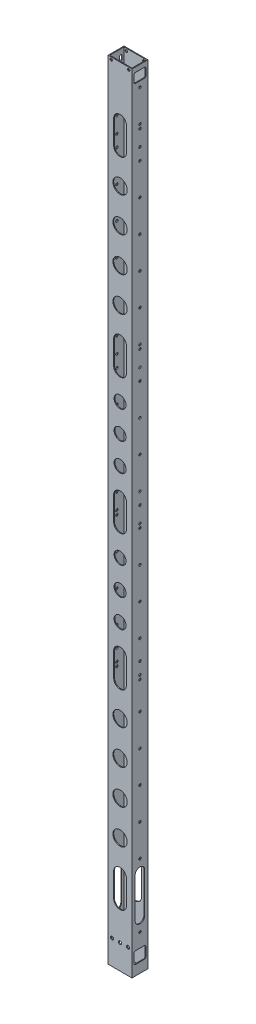
from build123d import *

# Parameters (mm, degrees)
SKETCH_1_W           = 30
SKETCH_1_H           = 20
SKETCH_1_W_2         = 28
SKETCH_1_H_2         = 18
EXTRUDE_1_DEPTH      = 980
SKETCH_3_R           = 1.5
CUT_EXTRUDE_2_DEPTH  = 981.51007134
CUT_EXTRUDE_3_DEPTH  = 981.51007134
SKETCH_5_W           = 15
SKETCH_5_H           = 12
CUT_EXTRUDE_4_DEPTH  = 10
SKETCH_6_R           = 9
SKETCH_6_R_2         = 7.5
CUT_EXTRUDE_5_DEPTH  = 981.318825689
SKETCH_9_R           = 1.5
CUT_EXTRUDE_7_DEPTH  = 981.318825689
SKETCH_13_W          = 30
SKETCH_13_H          = 20
SKETCH_13_W_2        = 28
SKETCH_13_H_2        = 18
EXTRUDE_2_DEPTH      = 10
CUT_EXTRUDE_8_DEPTH  = 60
SKETCH_15_W          = 15
SKETCH_15_H          = 15
CUT_EXTRUDE_10_DEPTH = 5
FILLET_1_R           = 2
SKETCH_16_R          = 2
CUT_EXTRUDE_11_DEPTH = 90
FILLET_2_R           = 2
SKETCH_17_R          = 1.5
CUT_EXTRUDE_12_DEPTH = 40
CUT_EXTRUDE_15_DEPTH = 51


with BuildPart() as part:
    # 草图1 → 凸台-拉伸1 (new body)
    with BuildSketch(Plane(origin=(0, 0, 0), x_dir=(1, 0, 0), z_dir=(0, 1, 0))):
        Rectangle(SKETCH_1_W, SKETCH_1_H)
        Rectangle(SKETCH_1_W_2, SKETCH_1_H_2, mode=Mode.SUBTRACT)
    extrude(amount=EXTRUDE_1_DEPTH)

    # 草图3 → 切除-拉伸2 (cut, through all)
    with BuildSketch(Plane(origin=(15, 0, 0), x_dir=(0, 0, -1), z_dir=(1, 0, 0))):
        with Locations((0, 890)):
            Circle(SKETCH_3_R)
        with Locations((0, 910)):
            Circle(SKETCH_3_R)
        with Locations((0, 500)):
            Circle(SKETCH_3_R)
        with Locations((0, 480)):
            Circle(SKETCH_3_R)
        with Locations((0, 670)):
            Circle(SKETCH_3_R)
        with Locations((0, 650)):
            Circle(SKETCH_3_R)
        with Locations((0, 330)):
            Circle(SKETCH_3_R)
        with Locations((0, 310)):
            Circle(SKETCH_3_R)
        with Locations((0, 70)):
            Circle(SKETCH_3_R)
        with Locations((0, 90)):
            Circle(SKETCH_3_R)
    extrude(amount=-CUT_EXTRUDE_2_DEPTH, mode=Mode.SUBTRACT)

    # 草图4 → 切除-拉伸3 (cut, through all)
    with BuildSketch(Plane(origin=(15, 0, 0), x_dir=(0, 0, -1), z_dir=(1, 0, 0))):
        with BuildLine():
            Line((3.4, 968), (3.4, 972))
            ThreePointArc((3.4, 972), (5, 973.6), (6.6, 972))
            Line((6.6, 972), (6.6, 968))
            ThreePointArc((6.6, 968), (5, 966.4), (3.4, 968))
        make_face()
        with BuildLine():
            Line((-3.4, 968), (-3.4, 972))
            ThreePointArc((-3.4, 972), (-5, 973.6), (-6.6, 972))
            Line((-6.6, 972), (-6.6, 968))
            ThreePointArc((-6.6, 968), (-5, 966.4), (-3.4, 968))
        make_face()
    extrude(amount=-CUT_EXTRUDE_3_DEPTH, mode=Mode.SUBTRACT)

    # 草图5 → 切除-拉伸4 (cut)
    with BuildSketch(Plane(origin=(15, 0, 0), x_dir=(0, 0, -1), z_dir=(1, 0, 0))):
        with Locations((0, 968)):
            Rectangle(SKETCH_5_W, SKETCH_5_H)
    extrude(amount=-CUT_EXTRUDE_4_DEPTH, mode=Mode.SUBTRACT)

    # 草图6 → 切除-拉伸5 (cut, through all)
    with BuildSketch(Plane(origin=(0, 0, -10), x_dir=(-1, 0, 0), z_dir=(0, 0, -1))):
        with Locations((0, 135)):
            Circle(SKETCH_6_R)
        with Locations((0, 178.333333333)):
            Circle(SKETCH_6_R)
        with Locations((0, 221.666666667)):
            Circle(SKETCH_6_R)
        with Locations((0, 265)):
            Circle(SKETCH_6_R)
        with Locations((0, 845)):
            Circle(SKETCH_6_R)
        with Locations((0, 801.666666667)):
            Circle(SKETCH_6_R)
        with Locations((0, 758.333333333)):
            Circle(SKETCH_6_R)
        with Locations((0, 715)):
            Circle(SKETCH_6_R)
        with Locations((0, 440)):
            Circle(SKETCH_6_R_2)
        with Locations((0, 405)):
            Circle(SKETCH_6_R_2)
        with Locations((0, 370)):
            Circle(SKETCH_6_R_2)
        with Locations((0, 610)):
            Circle(SKETCH_6_R_2)
        with Locations((0, 575)):
            Circle(SKETCH_6_R_2)
        with Locations((0, 540)):
            Circle(SKETCH_6_R_2)
        with BuildLine():
            Line((-8, 65), (-8, 95))
            ThreePointArc((-8, 95), (0, 103), (8, 95))
            Line((8, 95), (8, 65))
            ThreePointArc((8, 65), (0, 57), (-8, 65))
        make_face()
        with BuildLine():
            Line((-8, 305), (-8, 335))
            ThreePointArc((-8, 335), (0, 343), (8, 335))
            Line((8, 335), (8, 305))
            ThreePointArc((8, 305), (0, 297), (-8, 305))
        make_face()
        with BuildLine():
            Line((-8, 475), (-8, 505))
            ThreePointArc((-8, 505), (0, 513), (8, 505))
            Line((8, 505), (8, 475))
            ThreePointArc((8, 475), (0, 467), (-8, 475))
        make_face()
        with BuildLine():
            Line((-8, 645), (-8, 675))
            ThreePointArc((-8, 675), (0, 683), (8, 675))
            Line((8, 675), (8, 645))
            ThreePointArc((8, 645), (0, 637), (-8, 645))
        make_face()
        with BuildLine():
            Line((-8, 885), (-8, 915))
            ThreePointArc((-8, 915), (0, 923), (8, 915))
            Line((8, 915), (8, 885))
            ThreePointArc((8, 885), (0, 877), (-8, 885))
        make_face()
    extrude(amount=-CUT_EXTRUDE_5_DEPTH, mode=Mode.SUBTRACT)

    # 草图9 → 切除-拉伸7 (cut, through all)
    with BuildSketch(Plane.XY.offset(10)):
        with Locations((11, 977)):
            Circle(SKETCH_9_R)
        with Locations((-11, 977)):
            Circle(SKETCH_9_R)
    extrude(amount=-CUT_EXTRUDE_7_DEPTH, mode=Mode.SUBTRACT)

    # 草图13 → 凸台-拉伸2 (add)
    with BuildSketch(Plane.XZ):
        Rectangle(SKETCH_13_W, SKETCH_13_H)
        Rectangle(SKETCH_13_W_2, SKETCH_13_H_2, mode=Mode.SUBTRACT)
    extrude(amount=EXTRUDE_2_DEPTH)

    # 草图11 → 切除-拉伸8 (cut)
    with BuildSketch(Plane(origin=(-14, 0, 0), x_dir=(0, 0, -1), z_dir=(1, 0, 0))):
        with BuildLine():
            Line((-6.6, 5), (-6.6, 15))
            ThreePointArc((-6.6, 15), (-5, 16.6), (-3.4, 15))
            Line((-3.4, 15), (-3.4, 5))
            ThreePointArc((-3.4, 5), (-5, 3.4), (-6.6, 5))
        make_face()
        with BuildLine():
            Line((6.6, 5), (6.6, 15))
            ThreePointArc((6.6, 15), (5, 16.6), (3.4, 15))
            Line((3.4, 15), (3.4, 5))
            ThreePointArc((3.4, 5), (5, 3.4), (6.6, 5))
        make_face()
    extrude(amount=-CUT_EXTRUDE_8_DEPTH, mode=Mode.SUBTRACT)

    # 草图15 → 切除-拉伸10 (cut)
    with BuildSketch(Plane(origin=(15, 0, 0), x_dir=(0, 0, -1), z_dir=(1, 0, 0))):
        with Locations((0, 10)):
            Rectangle(SKETCH_15_W, SKETCH_15_H)
    extrude(amount=-CUT_EXTRUDE_10_DEPTH, mode=Mode.SUBTRACT)

    # 圆角1
    fillet_1_edges = [part.edges().sort_by_distance(p)[0] for p in [
        (14.5, 2.5, -7.5),
        (14.5, 2.5, 7.5),
        (14.5, 17.5, -7.5),
        (14.5, 17.5, 7.5),
    ]]
    fillet(fillet_1_edges, radius=FILLET_1_R)

    # 草图16 → 切除-拉伸11 (cut)
    with BuildSketch(Plane.XY.offset(10)):
        with Locations((10, 21)):
            Circle(SKETCH_16_R)
        with Locations((0, 21)):
            Circle(SKETCH_16_R)
        with Locations((-10, 21)):
            Circle(SKETCH_16_R)
    extrude(amount=-CUT_EXTRUDE_11_DEPTH, mode=Mode.SUBTRACT)

    # 圆角2
    fillet_2_edges = [part.edges().sort_by_distance(p)[0] for p in [
        (14.5, 962, -7.5),
        (14.5, 962, 7.5),
        (14.5, 974, 7.5),
        (14.5, 974, -7.5),
    ]]
    fillet(fillet_2_edges, radius=FILLET_2_R)

    # 草图17 → 切除-拉伸12 (cut)
    with BuildSketch(Plane(origin=(15, 0, 0), x_dir=(0, 0, -1), z_dir=(1, 0, 0))):
        with Locations((0, 955)):
            Circle(SKETCH_17_R)
        with Locations((0, 915)):
            Circle(SKETCH_17_R)
        with Locations((0, 875)):
            Circle(SKETCH_17_R)
        with Locations((0, 835)):
            Circle(SKETCH_17_R)
        with Locations((0, 795)):
            Circle(SKETCH_17_R)
        with Locations((0, 755)):
            Circle(SKETCH_17_R)
        with Locations((0, 715)):
            Circle(SKETCH_17_R)
        with Locations((0, 675)):
            Circle(SKETCH_17_R)
        with Locations((0, 635)):
            Circle(SKETCH_17_R)
        with Locations((0, 595)):
            Circle(SKETCH_17_R)
        with Locations((0, 555)):
            Circle(SKETCH_17_R)
        with Locations((0, 515)):
            Circle(SKETCH_17_R)
        with Locations((0, 475)):
            Circle(SKETCH_17_R)
        with Locations((0, 435)):
            Circle(SKETCH_17_R)
        with Locations((0, 395)):
            Circle(SKETCH_17_R)
        with Locations((0, 355)):
            Circle(SKETCH_17_R)
        with Locations((0, 315)):
            Circle(SKETCH_17_R)
        with Locations((0, 275)):
            Circle(SKETCH_17_R)
        with Locations((0, 235)):
            Circle(SKETCH_17_R)
        with Locations((0, 195)):
            Circle(SKETCH_17_R)
        with Locations((0, 155)):
            Circle(SKETCH_17_R)
        with Locations((0, 115)):
            Circle(SKETCH_17_R)
        with Locations((0, 75)):
            Circle(SKETCH_17_R)
        with Locations((0, 35)):
            Circle(SKETCH_17_R)
    extrude(amount=-CUT_EXTRUDE_12_DEPTH, mode=Mode.SUBTRACT)

    # 草图20 → 切除-拉伸15 (cut)
    with BuildSketch(Plane(origin=(15, 0, 0), x_dir=(0, 0, -1), z_dir=(1, 0, 0))):
        with BuildLine():
            Line((-6, 50), (-6, 100))
            ThreePointArc((-6, 100), (0, 106), (6, 100))
            Line((6, 100), (6, 50))
            ThreePointArc((6, 50), (0, 44), (-6, 50))
        make_face()
    extrude(amount=-CUT_EXTRUDE_15_DEPTH, mode=Mode.SUBTRACT)


solid = part.part
